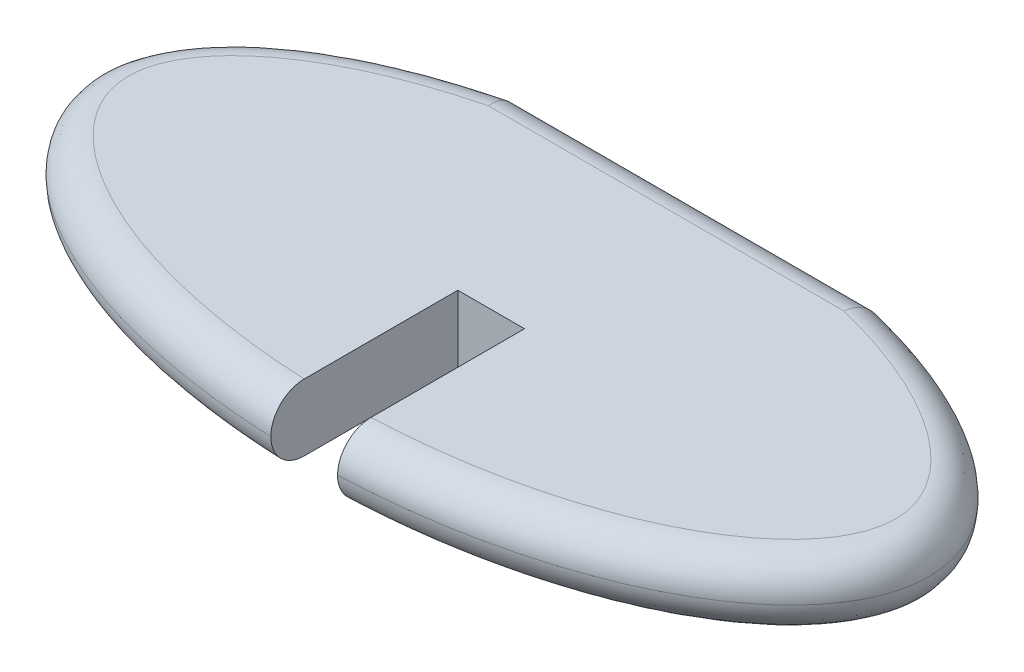
from build123d import *

# Parameters (mm, degrees)
BOSS_EXTRUDE1_DEPTH = 8
CUT_EXTRUDE1_DEPTH  = 57.471231761
FILLET1_R           = 4


with BuildPart() as part:
    # Sketch1 → Boss-Extrude1 (new body)
    with BuildSketch(Plane(origin=(0, 0, 0), x_dir=(1, 0, 0), z_dir=(0, 1, 0))):
        with BuildLine():
            Line((21.794494718, 22.5), (-21.794494718, 22.5))
            add(Edge.make_bspline(
                [(-21.794494718, 22.5), (-50, 15.669725157), (-50, 0)],
                knots=[5.163415792, 5.163415792, 5.163415792, 6.283185307, 6.283185307, 6.283185307], degree=2, weights=[1, 0.847316321, 1]))
            add(Edge.make_bspline(
                [(-50, 0), (-50, -45.174644857), (26.55442773, -21.182908015), (103.10885546, 2.808828826), (21.794494718, 22.5)],
                knots=[0, 0, 0, 2.130681084, 2.130681084, 4.261362169, 4.261362169, 4.261362169], degree=2, weights=[1, 0.484206281, 1, 0.484206281, 1]))
        make_face()
    extrude(amount=BOSS_EXTRUDE1_DEPTH)

    # Sketch2 → Cut-Extrude1 (cut, through all)
    with BuildSketch(Plane(origin=(0, 8, 0), x_dir=(1, 0, 0), z_dir=(0, 1, 0))):
        with BuildLine():
            Line((-4, -24.919871589), (-4, -2.5))
            Line((-4, -2.5), (4, -2.5))
            Line((4, -2.5), (4, -24.919871589))
            add(Edge.make_bspline(
                [(-4, -24.919871589), (0, -25.08038606), (4, -24.919871589)],
                knots=[1.490710747, 1.490710747, 1.490710747, 1.650881907, 1.650881907, 1.650881907], degree=2, weights=[1, 0.996794864, 1]))
        make_face()
    extrude(amount=-CUT_EXTRUDE1_DEPTH, mode=Mode.SUBTRACT)

    # Fillet1
    fillet1_edges = [part.edges().sort_by_distance(p)[0] for p in [
        (-38.369447746, 0, 16.029546778),
        (48.664099514, 0, 5.740327049),
        (0, 0, -22.5),
        (48.664099514, 8, 5.740327049),
        (-38.369447746, 8, 16.029546778),
        (0, 8, -22.5),
    ]]
    fillet(fillet1_edges, radius=FILLET1_R - 0.0001)  # a hair under: the kernel refuses the full size


solid = part.part
